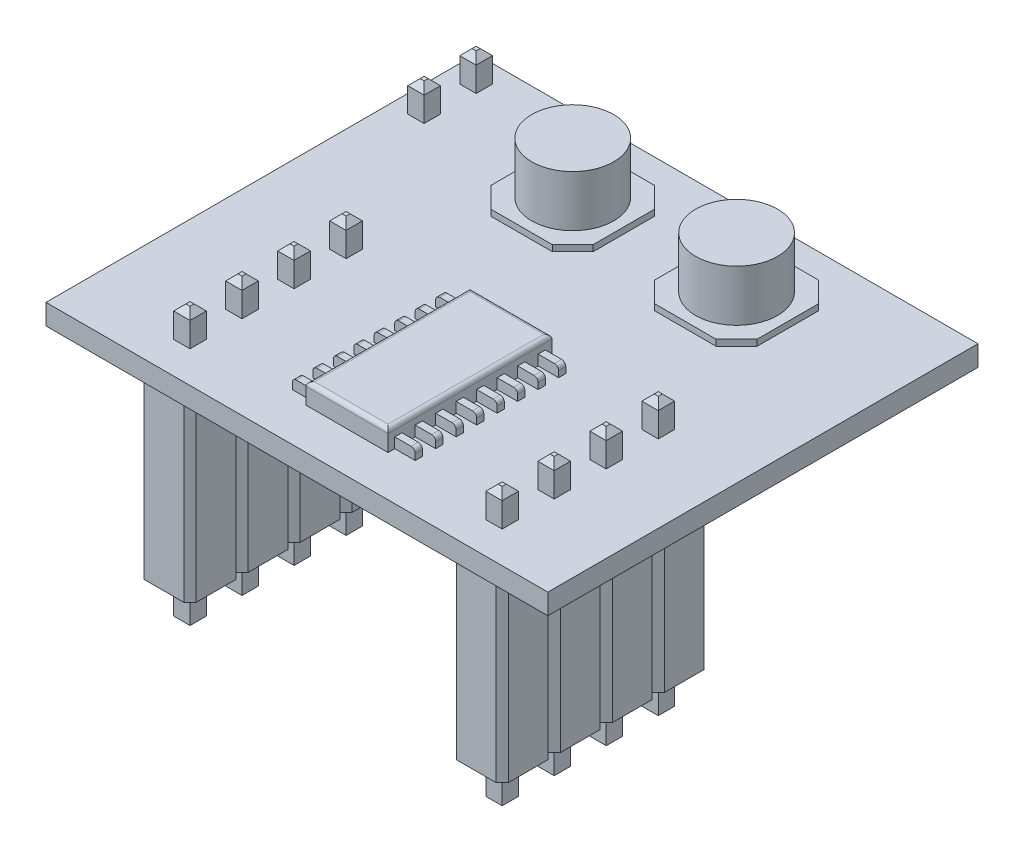
from build123d import *

# Parameters (mm, degrees)
ESQUISSE1_W                             = 24.5
ESQUISSE1_H                             = 21
BOSS_EXTRU_1_DEPTH                      = 1
BOSS_EXTRU_2_START                      = -12
ESQUISSE2_W                             = 0.8
ESQUISSE2_H                             = 0.8
BOSS_EXTRU_2_DEPTH                      = 13.5
CHANFREIN1_SIZE                         = 0.3
BOSS_EXTRU_3_DEPTH                      = 9
R_P_TITION_START                        = -9
R_P_TITION_LIN_AIRE2_DEPTH              = 9
R_P_TITION_START_2                      = 1.17
R_P_TITION_LIN_AIRE2_2_DEPTH            = 0.2
R_P_TITION_START_3                      = 3.41
R_P_TITION_LIN_AIRE2_3_DEPTH            = 0.8
R_P_TITION_LIN_AIRE2_4_DEPTH            = 3
BOSS_EXTRU_4_START                      = -12
ESQUISSE4_W                             = 0.8
ESQUISSE4_H                             = 0.8
BOSS_EXTRU_4_DEPTH                      = 13.5
CHANFREIN2_SIZE                         = 0.3
BOSS_EXTRU_5_DEPTH                      = 9
R_P_TITION_LIN_AIRE3_COUNT              = 4
R_P_TITION_LIN_AIRE3_PITCH              = 2.54
CHANFREIN2_OF_R_P_TITION_LIN_AIRE3_SIZE = 0.3
BOSS_EXTRU_6_DEPTH                      = 0.3
ESQUISSE7_R                             = 2
BOSS_EXTRU_7_DEPTH                      = 2.5
ESQUISSE8_W                             = 4
ESQUISSE8_H                             = 8
BOSS_EXTRU_8_DEPTH                      = 1
CONG_1_R                                = 0.2
ESQUISSE9_W                             = 1
ESQUISSE9_H                             = 0.35
BOSS_EXTRU_9_DEPTH                      = 0.5
CONG_2_R                                = 0.2
R_P_TITION_LIN_AIRE4_COUNT              = 8
R_P_TITION_LIN_AIRE4_PITCH              = 1
CONG_2_OF_R_P_TITION_LIN_AIRE4_R        = 0.2


with BuildPart() as part:
    # Esquisse1 → Boss.-Extru.1 (new body)
    with BuildSketch(Plane(origin=(0, 0, 0), x_dir=(1, 0, 0), z_dir=(0, 1, 0))):
        with Locations((12.25, -10.5)):
            Rectangle(ESQUISSE1_W, ESQUISSE1_H)
    extrude(amount=BOSS_EXTRU_1_DEPTH)

    # Esquisse2 → Boss.-Extru.2 (add)
    with BuildSketch(Plane(origin=(0, 1, 0), x_dir=(1, 0, 0), z_dir=(0, 1, 0)).offset(BOSS_EXTRU_2_START)):
        with Locations((1.27, -1.27)):
            Rectangle(ESQUISSE2_W, ESQUISSE2_H)
    extrude(amount=BOSS_EXTRU_2_DEPTH)

    # Chanfrein1
    chanfrein1_edges = [part.edges().sort_by_distance(p)[0] for p in [
        (1.67, -11, 1.27),
        (1.27, -11, 1.67),
        (0.87, -11, 1.27),
        (1.27, -11, 0.87),
        (1.67, 2.5, 1.27),
        (1.27, 2.5, 0.87),
        (0.87, 2.5, 1.27),
        (1.27, 2.5, 1.67),
    ]]
    chamfer(chanfrein1_edges, length=CHANFREIN1_SIZE)

    # R_p_tition lin_aire2 2 outline → R_p_tition lin_aire2 2 (add)
    with BuildSketch(Plane.YZ.offset(R_P_TITION_START_2)):
        Polygon((-11, 3.91), (-11, 3.71), (-10.7, 3.41), (0, 3.41), (0, 4.21), (-10.7, 4.21), align=None)
        Polygon((2.2, 3.41), (2.5, 3.71), (2.5, 3.91), (2.2, 4.21), (1, 4.21), (1, 3.41), align=None)
    extrude(amount=R_P_TITION_LIN_AIRE2_2_DEPTH)

    # R_p_tition lin_aire2 3 outline → R_p_tition lin_aire2 3 (add)
    with BuildSketch(Plane.XY.offset(R_P_TITION_START_3)):
        Polygon((1.17, 0), (0.87, 0), (0.87, -10.7), (1.17, -11), align=None)
        Polygon((1.67, 0), (1.37, 0), (1.37, -11), (1.67, -10.7), align=None)
        Polygon((1.17, 2.5), (0.87, 2.2), (0.87, 1), (1.17, 1), align=None)
        Polygon((1.37, 2.5), (1.37, 1), (1.67, 1), (1.67, 2.2), align=None)
    extrude(amount=R_P_TITION_LIN_AIRE2_3_DEPTH)

    # R_p_tition lin_aire2 4 outline → R_p_tition lin_aire2 4 (cut)
    with BuildSketch(Plane.YZ):
        Polygon((-11.1, 3.81), (-10.7, 4.21), (-11.5, 4.21), align=None)
        Polygon((-10.7, 3.41), (-11.1, 3.81), (-11.5, 3.41), align=None)
        Polygon((3, 4.21), (2.2, 4.21), (2.6, 3.81), align=None)
        Polygon((3, 3.41), (2.6, 3.81), (2.2, 3.41), align=None)
    extrude(amount=R_P_TITION_LIN_AIRE2_4_DEPTH, mode=Mode.SUBTRACT)

    # Esquisse4 → Boss.-Extru.4 (add)
    with BuildSketch(Plane(origin=(0, 1, 0), x_dir=(1, 0, 0), z_dir=(0, 1, 0)).offset(BOSS_EXTRU_4_START)):
        with Locations((5.08, -11.43)):
            Rectangle(ESQUISSE4_W, ESQUISSE4_H)
        with Locations((20.32, -11.43)):
            Rectangle(ESQUISSE4_W, ESQUISSE4_H)
    boss_extru_4 = extrude(amount=BOSS_EXTRU_4_DEPTH)

    # Chanfrein2
    chanfrein2_edges = [part.edges().sort_by_distance(p)[0] for p in [
        (5.48, -11, 11.43),
        (5.08, -11, 11.83),
        (4.68, -11, 11.43),
        (5.08, -11, 11.03),
        (5.48, 2.5, 11.43),
        (5.08, 2.5, 11.03),
        (4.68, 2.5, 11.43),
        (5.08, 2.5, 11.83),
        (20.72, -11, 11.43),
        (20.32, -11, 11.83),
        (19.92, -11, 11.43),
        (20.32, -11, 11.03),
        (20.72, 2.5, 11.43),
        (20.32, 2.5, 11.03),
        (19.92, 2.5, 11.43),
        (20.32, 2.5, 11.83),
    ]]
    chamfer(chanfrein2_edges, length=CHANFREIN2_SIZE)

    # Esquisse5 → Boss.-Extru.5 (add)
    with BuildSketch(Plane.XZ):
        Polygon((6.05, 10.16), (4.11, 10.16), (3.81, 10.46), (3.81, 12.4), (4.11, 12.7), (6.05, 12.7), (6.35, 12.4), (6.35, 10.46), align=None)
        Polygon((21.29, 12.7), (19.35, 12.7), (19.05, 12.4), (19.05, 10.46), (19.35, 10.16), (21.29, 10.16), (21.59, 10.46), (21.59, 12.4), align=None)
    boss_extru_5 = extrude(amount=BOSS_EXTRU_5_DEPTH)

    # Répétition linéaire3: Boss.-Extru.4, Boss.-Extru.5 ×4
    with Locations(*[(0, 0, i * R_P_TITION_LIN_AIRE3_PITCH) for i in range(1, R_P_TITION_LIN_AIRE3_COUNT)]):
        add(boss_extru_4)
        add(boss_extru_5)

    # Chanfrein2 of Répétition linéaire3
    chanfrein2_of_r_p_tition_lin_aire3_edges = [part.edges().sort_by_distance(p)[0] for p in [
        (5.48, -11, 13.97),
        (5.08, -11, 14.37),
        (4.68, -11, 13.97),
        (5.08, -11, 13.57),
        (5.48, 2.5, 13.97),
        (5.08, 2.5, 13.57),
        (4.68, 2.5, 13.97),
        (5.08, 2.5, 14.37),
        (20.72, -11, 13.97),
        (20.32, -11, 14.37),
        (19.92, -11, 13.97),
        (20.32, -11, 13.57),
        (20.72, 2.5, 13.97),
        (20.32, 2.5, 13.57),
        (19.92, 2.5, 13.97),
        (20.32, 2.5, 14.37),
        (5.48, -11, 16.51),
        (5.08, -11, 16.91),
        (4.68, -11, 16.51),
        (5.08, -11, 16.11),
        (5.48, 2.5, 16.51),
        (5.08, 2.5, 16.11),
        (4.68, 2.5, 16.51),
        (5.08, 2.5, 16.91),
        (20.72, -11, 16.51),
        (20.32, -11, 16.91),
        (19.92, -11, 16.51),
        (20.32, -11, 16.11),
        (20.72, 2.5, 16.51),
        (20.32, 2.5, 16.11),
        (19.92, 2.5, 16.51),
        (20.32, 2.5, 16.91),
        (5.48, -11, 19.05),
        (5.08, -11, 19.45),
        (4.68, -11, 19.05),
        (5.08, -11, 18.65),
        (5.48, 2.5, 19.05),
        (5.08, 2.5, 18.65),
        (4.68, 2.5, 19.05),
        (5.08, 2.5, 19.45),
        (20.72, -11, 19.05),
        (20.32, -11, 19.45),
        (19.92, -11, 19.05),
        (20.32, -11, 18.65),
        (20.72, 2.5, 19.05),
        (20.32, 2.5, 18.65),
        (19.92, 2.5, 19.05),
        (20.32, 2.5, 19.45),
    ]]
    chamfer(chanfrein2_of_r_p_tition_lin_aire3_edges, length=CHANFREIN2_OF_R_P_TITION_LIN_AIRE3_SIZE)

    # Esquisse6 → Boss.-Extru.6 (add)
    with BuildSketch(Plane(origin=(0, 1, 0), x_dir=(1, 0, 0), z_dir=(0, 1, 0))):
        Polygon((7.215, -6.5), (10.215, -6.5), (11.215, -5.5), (11.215, -2.5), (10.215, -1.5), (7.215, -1.5), (6.215, -2.5), (6.215, -5.5), align=None)
        Polygon((15.215, -1.5), (14.215, -2.5), (14.215, -5.5), (15.215, -6.5), (18.215, -6.5), (19.215, -5.5), (19.215, -2.5), (18.215, -1.5), align=None)
    extrude(amount=BOSS_EXTRU_6_DEPTH)

    # Esquisse7 → Boss.-Extru.7 (add)
    with BuildSketch(Plane(origin=(0, 1.3, 0), x_dir=(1, 0, 0), z_dir=(0, 1, 0))):
        with Locations(Location((8.715, -4, 0), (0, 0, 270))):
            Circle(ESQUISSE7_R)
        with Locations(Location((16.715, -4, 0), (0, 0, 270))):
            Circle(ESQUISSE7_R)
    extrude(amount=BOSS_EXTRU_7_DEPTH)

    # Esquisse8 → Boss.-Extru.8 (add)
    with BuildSketch(Plane(origin=(0, 1, 0), x_dir=(1, 0, 0), z_dir=(0, 1, 0))):
        with Locations((12.7, -15)):
            Rectangle(ESQUISSE8_W, ESQUISSE8_H)
    extrude(amount=BOSS_EXTRU_8_DEPTH)

    # Congé1
    cong_1_edges = [part.edges().sort_by_distance(p)[0] for p in [
        (10.7, 2, 15),
        (12.7, 2, 19),
        (14.7, 2, 15),
        (12.7, 2, 11),
    ]]
    fillet(cong_1_edges, radius=CONG_1_R)

    # Esquisse9 → Boss.-Extru.9 (add)
    with BuildSketch(Plane(origin=(0, 1, 0), x_dir=(1, 0, 0), z_dir=(0, 1, 0))):
        with Locations((15.2, -18.5)):
            Rectangle(ESQUISSE9_W, ESQUISSE9_H)
        with Locations((10.2, -18.5)):
            Rectangle(ESQUISSE9_W, ESQUISSE9_H)
    boss_extru_9 = extrude(amount=BOSS_EXTRU_9_DEPTH)

    # Congé2
    cong_2_edges = [part.edges().sort_by_distance(p)[0] for p in [
        (15.7, 1.5, 18.5),
        (9.7, 1.5, 18.5),
    ]]
    fillet(cong_2_edges, radius=CONG_2_R)

    # Répétition linéaire4: Boss.-Extru.9 ×8
    with Locations(*[(0, 0, -i * R_P_TITION_LIN_AIRE4_PITCH) for i in range(1, R_P_TITION_LIN_AIRE4_COUNT)]):
        add(boss_extru_9)

    # Congé2 of Répétition linéaire4
    cong_2_of_r_p_tition_lin_aire4_edges = [part.edges().sort_by_distance(p)[0] for p in [
        (15.7, 1.5, 17.5),
        (9.7, 1.5, 17.5),
        (15.7, 1.5, 16.5),
        (9.7, 1.5, 16.5),
        (15.7, 1.5, 15.5),
        (9.7, 1.5, 15.5),
        (15.7, 1.5, 14.5),
        (9.7, 1.5, 14.5),
        (15.7, 1.5, 13.5),
        (9.7, 1.5, 13.5),
        (15.7, 1.5, 12.5),
        (9.7, 1.5, 12.5),
        (15.7, 1.5, 11.5),
        (9.7, 1.5, 11.5),
    ]]
    fillet(cong_2_of_r_p_tition_lin_aire4_edges, radius=CONG_2_OF_R_P_TITION_LIN_AIRE4_R)


with BuildPart() as body_2:
    # Esquisse3 → Boss.-Extru.3 (new body)
    with BuildSketch(Plane.XZ):
        Polygon((2.24, 0), (0.3, 0), (0, 0.3), (0, 2.24), (0.3, 2.54), (2.24, 2.54), (2.54, 2.24), (2.54, 0.3), align=None)
    extrude(amount=BOSS_EXTRU_3_DEPTH)


with BuildPart() as body_3:
    # Répétition linéaire2: read off the stored shape, not the designer's step
    # Répétition linéaire2 outline → Répétition linéaire2 (new body)
    with BuildSketch(Plane(origin=(0, 0, 0), x_dir=(1, 0, 0), z_dir=(0, 1, 0)).offset(R_P_TITION_START)):
        Polygon((0, -4.78), (0.3, -5.08), (2.24, -5.08), (2.54, -4.78), (2.54, -2.84), (2.24, -2.54), (0.3, -2.54), (0, -2.84), align=None)
    extrude(amount=R_P_TITION_LIN_AIRE2_DEPTH)


solid = Compound([part.part, body_2.part, body_3.part])
